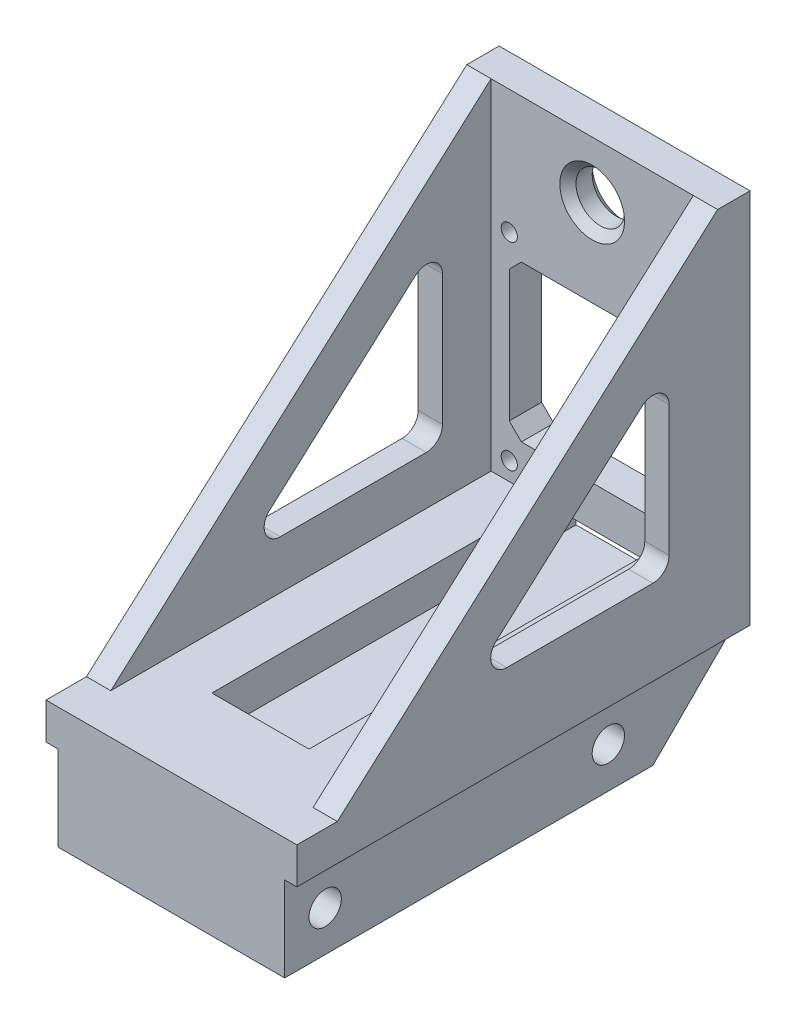
from build123d import *

# Parameters (mm, degrees)
SKETCH2_W           = 25
SKETCH2_H           = 42
BOSS_EXTRUDE1_DEPTH = 4
SKETCH5_W           = 56
SKETCH5_H           = 15
BOSS_EXTRUDE2_DEPTH = 25
BOSS_EXTRUDE3_DEPTH = 3
SKETCH7_W           = 1.5
SKETCH7_H           = 10.5
CUT_EXTRUDE1_DEPTH  = 69.353858706
SKETCH9_R           = 2
CUT_EXTRUDE2_DEPTH  = 6
CHAMFER1_SIZE       = 10.5
SKETCH10_R          = 1
CUT_EXTRUDE3_DEPTH  = 66.117202028
SKETCH11_W          = 20.5
SKETCH11_H          = 19.25
CUT_EXTRUDE4_DEPTH  = 66.117202028
CHAMFER3_SIZE       = 1.5
SKETCH12_R          = 3
CUT_EXTRUDE5_DEPTH  = 66.117202028
CHAMFER4_SIZE       = 1
SKETCH13_R          = 2
CUT_EXTRUDE6_DEPTH  = 1.5
CUT_EXTRUDE7_DEPTH  = 73.221880341
FILLET1_R           = 2
SKETCH16_W          = 12
SKETCH16_H          = 45
CUT_EXTRUDE8_DEPTH  = 4.5
CHAMFER5_SIZE       = 4.5


with BuildPart() as part:
    # Sketch2 → Boss-Extrude1 (new body)
    with BuildSketch(Plane.XY):
        Rectangle(SKETCH2_W, SKETCH2_H)
    extrude(amount=BOSS_EXTRUDE1_DEPTH)

    # Sketch5 → Boss-Extrude2 (add, through all)
    with BuildSketch(Plane(origin=(12.5, 0, 0), x_dir=(0, 0, -1), z_dir=(1, 0, 0))):
        with Locations((-28, -28.5)):
            Rectangle(SKETCH5_W, SKETCH5_H)
    extrude(amount=-BOSS_EXTRUDE2_DEPTH)

    # Sketch6 → Boss-Extrude3 (add)
    with BuildSketch(Plane(origin=(12.5, 0, 0), x_dir=(0, 0, -1), z_dir=(1, 0, 0))):
        Polygon((-4, 21), (0, 21), (0, -36), (-56, -36), (-56, -21), (-51, -21), align=None)
    boss_extrude3 = extrude(amount=BOSS_EXTRUDE3_DEPTH)

    # Sketch7 → Cut-Extrude1 (cut, through all)
    with BuildSketch(Plane.XY.offset(56)):
        with Locations((14.75, -30.75)):
            Rectangle(SKETCH7_W, SKETCH7_H)
    cut_extrude1 = extrude(amount=-CUT_EXTRUDE1_DEPTH, mode=Mode.SUBTRACT)

    # Sketch9 → Cut-Extrude2 (cut)
    with BuildSketch(Plane(origin=(14, 0, 0), x_dir=(0, 0, -1), z_dir=(1, 0, 0))):
        with Locations((-51, -31)):
            Circle(SKETCH9_R)
        with Locations((-16, -31)):
            Circle(SKETCH9_R)
    cut_extrude2 = extrude(amount=-CUT_EXTRUDE2_DEPTH, mode=Mode.SUBTRACT)

    # Mirror1: Boss-Extrude3, Cut-Extrude1, Cut-Extrude2 across plane
    add(boss_extrude3.mirror(Plane(origin=(0, 0, 0), x_dir=(0, 0, 1), z_dir=(1, 0, 0))))
    add(cut_extrude1.mirror(Plane(origin=(0, 0, 0), x_dir=(0, 0, 1), z_dir=(1, 0, 0))), mode=Mode.SUBTRACT)
    add(cut_extrude2.mirror(Plane(origin=(0, 0, 0), x_dir=(0, 0, 1), z_dir=(1, 0, 0))), mode=Mode.SUBTRACT)

    # Chamfer1
    chamfer1_edges = [part.edges().sort_by_distance(p)[0] for p in [
        (0, -36, 0),
    ]]
    chamfer(chamfer1_edges, length=CHAMFER1_SIZE)

    # Sketch10 → Cut-Extrude3 (cut, through all)
    with BuildSketch(Plane.XY.offset(4)):
        with Locations((-10.25, 5.7)):
            Circle(SKETCH10_R)
        with Locations((10.25, 5.7)):
            Circle(SKETCH10_R)
        with Locations((10.25, -18.75)):
            Circle(SKETCH10_R)
        with Locations((-10.25, -18.75)):
            Circle(SKETCH10_R)
    extrude(amount=-CUT_EXTRUDE3_DEPTH, mode=Mode.SUBTRACT)

    # Sketch11 → Cut-Extrude4 (cut, through all)
    with BuildSketch(Plane.XY.offset(4)):
        with Locations((0, -6.375)):
            Rectangle(SKETCH11_W, SKETCH11_H)
    extrude(amount=-CUT_EXTRUDE4_DEPTH, mode=Mode.SUBTRACT)

    # Chamfer3
    chamfer3_edges = [part.edges().sort_by_distance(p)[0] for p in [
        (10.25, 3.25, 2),
        (10.25, -16, 2),
        (-10.25, -16, 2),
        (-10.25, 3.25, 2),
    ]]
    chamfer(chamfer3_edges, length=CHAMFER3_SIZE)

    # Sketch12 → Cut-Extrude5 (cut, through all)
    with BuildSketch(Plane.XY.offset(4)):
        with Locations((0, 14)):
            Circle(SKETCH12_R)
    extrude(amount=-CUT_EXTRUDE5_DEPTH, mode=Mode.SUBTRACT)

    # Chamfer4
    chamfer4_edges = [part.edges().sort_by_distance(p)[0] for p in [
        (-3, 14, 0),
        (-3, 14, 4),
    ]]
    chamfer(chamfer4_edges, length=CHAMFER4_SIZE)

    # Sketch13 → Cut-Extrude6 (cut)
    with BuildSketch(Plane(origin=(0, 0, 0), x_dir=(-1, 0, 0), z_dir=(0, 0, -1))):
        with Locations((-10.25, 5.7)):
            Circle(SKETCH13_R)
        with Locations((10.25, 5.7)):
            Circle(SKETCH13_R)
        with Locations((10.25, -18.75)):
            Circle(SKETCH13_R)
        with Locations((-10.25, -18.75)):
            Circle(SKETCH13_R)
    extrude(amount=-CUT_EXTRUDE6_DEPTH, mode=Mode.SUBTRACT)

    # Sketch14 → Cut-Extrude7 (cut, through all)
    with BuildSketch(Plane(origin=(-12.5, 0, 0), x_dir=(0, 0, -1), z_dir=(1, 0, 0))):
        Polygon((-35.28118028, -15), (-10, -15), (-10, 7.591693017), align=None)
    cut_extrude7 = extrude(amount=-CUT_EXTRUDE7_DEPTH, mode=Mode.SUBTRACT)

    # Mirror2: Cut-Extrude7 across plane
    add(cut_extrude7.mirror(Plane(origin=(0, 0, 0), x_dir=(0, 0, 1), z_dir=(1, 0, 0))), mode=Mode.SUBTRACT)

    # Fillet1
    fillet1_edges = [part.edges().sort_by_distance(p)[0] for p in [
        (-14, -15, 35.28118028),
        (-14, 7.591693017, 10),
        (-14, -15, 10),
        (14, 7.591693017, 10),
        (14, -15, 35.28118028),
        (14, -15, 10),
    ]]
    fillet(fillet1_edges, radius=FILLET1_R)

    # Sketch16 → Cut-Extrude8 (cut)
    with BuildSketch(Plane(origin=(0, -21, 0), x_dir=(1, 0, 0), z_dir=(0, 1, 0))):
        with Locations((0, -22.5)):
            Rectangle(SKETCH16_W, SKETCH16_H)
    extrude(amount=-CUT_EXTRUDE8_DEPTH, mode=Mode.SUBTRACT)

    # Chamfer5
    chamfer5_edges = [part.edges().sort_by_distance(p)[0] for p in [
        (0, -25.5, 45),
    ]]
    chamfer(chamfer5_edges, length=CHAMFER5_SIZE - 0.0001)  # a hair under: the kernel refuses the full size


solid = part.part
